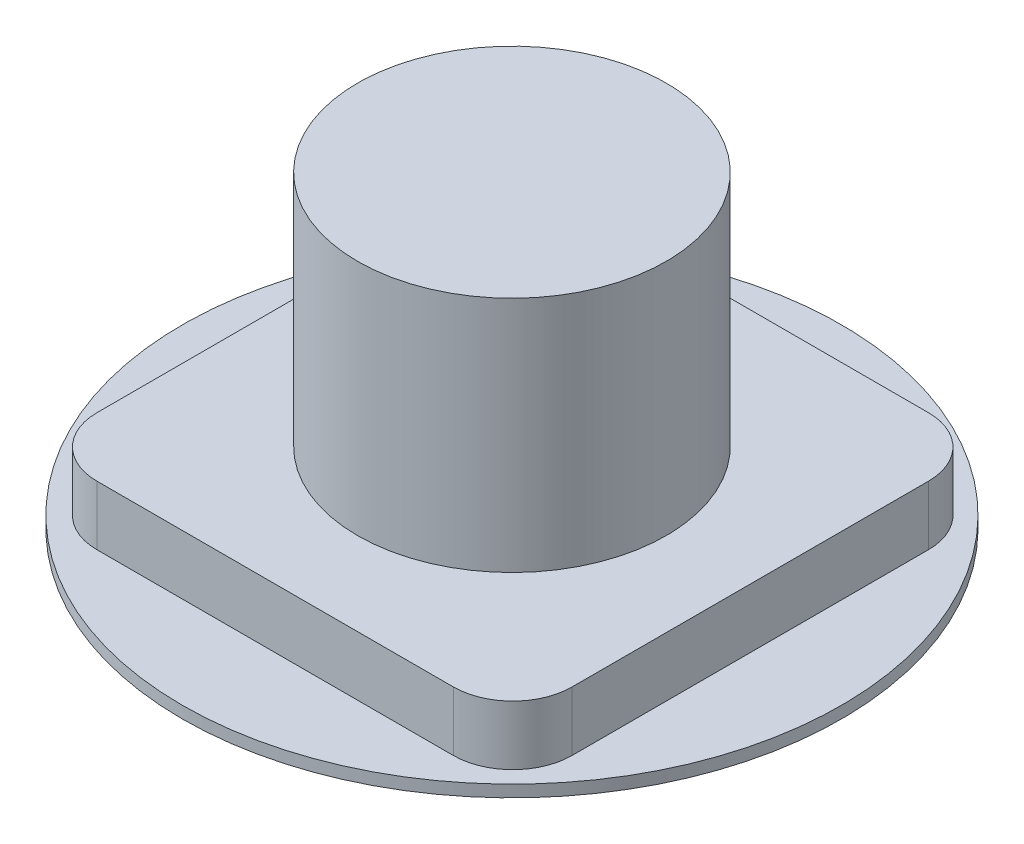
from build123d import *

# Parameters (mm, degrees)
SKETCH1_R           = 277.5
BOSS_EXTRUDE1_DEPTH = 10
SKETCH2_W           = 400
SKETCH2_H           = 400
BOSS_EXTRUDE2_DEPTH = 50
FILLET1_R           = 50
SKETCH3_R           = 130
BOSS_EXTRUDE3_DEPTH = 200


with BuildPart() as part:
    # Sketch1 → Boss-Extrude1 (new body)
    with BuildSketch(Plane(origin=(0, 0, 0), x_dir=(1, 0, 0), z_dir=(0, 1, 0))):
        with Locations(Location((0, 0, 0), (0, 0, 270))):
            Circle(SKETCH1_R)
    extrude(amount=BOSS_EXTRUDE1_DEPTH)

    # Sketch2 → Boss-Extrude2 (add)
    with BuildSketch(Plane(origin=(0, 10, 0), x_dir=(1, 0, 0), z_dir=(0, 1, 0))):
        with Locations((0.651230283, 0)):
            Rectangle(SKETCH2_W, SKETCH2_H)
    extrude(amount=BOSS_EXTRUDE2_DEPTH)

    # Fillet1
    # the kernel refuses this fillet: 50 mm, written as the material it takes off along each edge
    with BuildSketch(Plane(origin=(200.651230283, 10, 200), x_dir=(-1, 0, 0), z_dir=(0, 1, 0))) as fillet1_piece_1:
        with BuildLine():
            CenterArc((FILLET1_R, -FILLET1_R), FILLET1_R, 90, 90)
            Line((0, -FILLET1_R), (0, 0))
            Line((0, 0), (FILLET1_R, 0))
        make_face()
    extrude(amount=175, mode=Mode.SUBTRACT)
    with BuildSketch(Plane(origin=(200.651230283, 10, -200), x_dir=(-1, 0, 0), z_dir=(0, 1, 0)), Plane(origin=(-199.348769717, 10, -200), x_dir=(0, 0, 1), z_dir=(0, 1, 0)), Plane(origin=(-199.348769717, 10, 200), x_dir=(1, 0, 0), z_dir=(0, 1, 0))) as fillet1_piece_2:
        with BuildLine():
            CenterArc((FILLET1_R, FILLET1_R), FILLET1_R, 180, 90)
            Line((0, FILLET1_R), (0, 0))
            Line((0, 0), (FILLET1_R, 0))
        make_face()
    extrude(amount=175, mode=Mode.SUBTRACT)

    # Sketch3 → Boss-Extrude3 (add)
    with BuildSketch(Plane(origin=(0, 60, 0), x_dir=(1, 0, 0), z_dir=(0, 1, 0))):
        with Locations(Location((0, 0, 0), (0, 0, 270))):
            Circle(SKETCH3_R)
    extrude(amount=BOSS_EXTRUDE3_DEPTH)


solid = part.part
